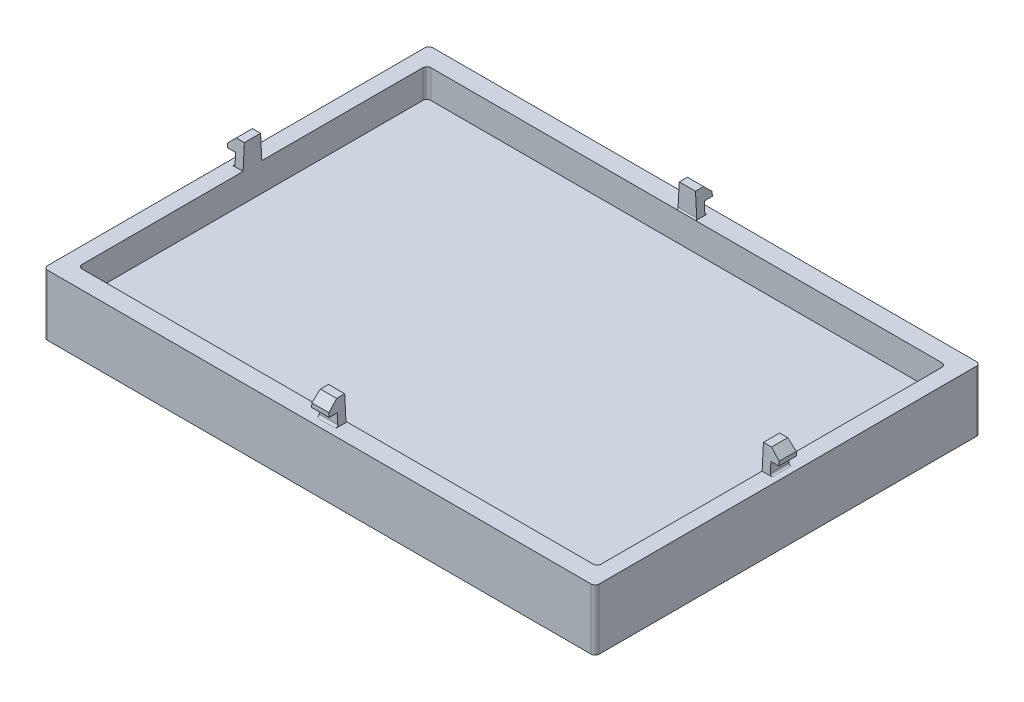
from build123d import *

# Parameters (mm, degrees)
SKETCH1_W            = 136
SKETCH1_H            = 95
BOSS_EXTRUDE1_DEPTH  = 15
SKETCH2_W            = 128
SKETCH2_H            = 86
CUT_EXTRUDE1_DEPTH   = 7
SNAP_START           = 64
SNAP_HOOK2_DEPTH     = 2
SNAP_HOOK2_2_DEPTH   = 2
FILLET1_R            = 1
FILLET2_R            = 0.5
FILLET2_OF_MIRROR1_R = 0.5
SNAP_START_2         = 43.25
SNAP_HOOK3_DEPTH     = 2
FILLET3_R            = 0.5
FILLET3_OF_MIRROR2_R = 0.5


with BuildPart() as part:
    # Sketch1 → Boss-Extrude1 (new body)
    with BuildSketch(Plane(origin=(0, 0, 0), x_dir=(1, 0, 0), z_dir=(0, 1, 0))):
        Rectangle(SKETCH1_W, SKETCH1_H)
    extrude(amount=BOSS_EXTRUDE1_DEPTH)

    # Sketch2 → Cut-Extrude1 (cut)
    with BuildSketch(Plane(origin=(0, 15, 0), x_dir=(1, 0, 0), z_dir=(0, 1, 0))):
        Rectangle(SKETCH2_W, SKETCH2_H)
    extrude(amount=-CUT_EXTRUDE1_DEPTH, mode=Mode.SUBTRACT)



with BuildPart() as body_2:
    # Snap Hook2: read off the stored shape, not the designer's step
    # Snap Hook2 outline → Snap Hook2 (new body)
    with BuildSketch(Plane.YZ.offset(SNAP_START)):
        Polygon((21, -2), (21, 2), (18, 2.157223338), (18, -2.157223338), align=None)
    snap_hook2 = extrude(amount=SNAP_HOOK2_DEPTH)


with BuildPart() as part_1:
    add(part.part)

    add(body_2.part)  # Snap Hook2 2 merges body 2
    # Snap Hook2 2 outline → Snap Hook2 2 (add)
    with BuildSketch(Plane.YZ.offset(SNAP_START)):
        Polygon((18, -2.157223338), (18, 2.157223338), (15, 2.314446676), (15, -2.314446676), align=None)
    snap_hook2_2 = extrude(amount=SNAP_HOOK2_2_DEPTH)

    # Snap Hook2 3: loft between two sections, ruled curve by curve
    snap_hook2_3_from = [
        Edge.make_line((66, 21, -2), (66, 21, 2)),
        Edge.make_line((66, 18, 2.157223338), (66, 18, -2.157223338)),
        Edge.make_line((66, 18, 2.157223338), (66, 21, 2)),
        Edge.make_line((66, 18, -2.157223338), (66, 21, -2)),
    ]
    snap_hook2_3_to = [
        Edge.make_line((68, 19, -2.104815559), (68, 19, 2.104815559)),
        Edge.make_line((68, 18, 2.157223338), (68, 18, -2.157223338)),
        Edge.make_line((68, 18, 2.157223338), (68, 19, 2.104815559)),
        Edge.make_line((68, 18, -2.157223338), (68, 19, -2.104815559)),
    ]
    snap_hook2_3 = Solid(Shell([*[Face.make_surface_from_curves(snap_hook2_3_from[k], snap_hook2_3_to[k]) for k in range(4)], Face(Wire(snap_hook2_3_from)), Face(Wire(snap_hook2_3_to))]))
    add(snap_hook2_3)

    # Fillet1
    fillet1_edges = [part_1.edges().sort_by_distance(p)[0] for p in [
        (-64, 11.5, 43),
        (-64, 11.5, -43),
        (64, 11.5, -43),
        (64, 11.5, 43),
        (68, 7.5, 47.5),
        (68, 7.5, -47.5),
        (-68, 7.5, -47.5),
        (-68, 7.5, 47.5),
    ]]
    fillet(fillet1_edges, radius=FILLET1_R)

    # Fillet2
    fillet2_edges = [part_1.edges().sort_by_distance(p)[0] for p in [
        (66, 15, 0),
    ]]
    fillet(fillet2_edges, radius=FILLET2_R)

    # Mirror1: Snap Hook2, Snap Hook2 2, Snap Hook2 3 across plane
    add(snap_hook2.mirror(Plane(origin=(0, 0, 0), x_dir=(0, 0, 1), z_dir=(1, 0, 0))))
    add(snap_hook2_2.mirror(Plane(origin=(0, 0, 0), x_dir=(0, 0, 1), z_dir=(1, 0, 0))))
    add(snap_hook2_3.mirror(Plane(origin=(0, 0, 0), x_dir=(0, 0, 1), z_dir=(1, 0, 0))))

    # Fillet2 of Mirror1
    fillet2_of_mirror1_edges = [part_1.edges().sort_by_distance(p)[0] for p in [
        (-66, 15, 0),
    ]]
    fillet(fillet2_of_mirror1_edges, radius=FILLET2_OF_MIRROR1_R)

    # Snap Hook3: read off the stored shape, not the designer's step
    # Snap Hook3 outline → Snap Hook3 (add)
    with BuildSketch(Plane.XY.offset(SNAP_START_2)):
        Polygon((2, 21), (-2, 21), (-2.314446676, 15), (2.314446676, 15), align=None)
    snap_hook3 = extrude(amount=SNAP_HOOK3_DEPTH)

    # Snap Hook3 2: loft between two sections, ruled curve by curve
    snap_hook3_2_from = [
        Edge.make_line((-2.157223338, 18, 45.25), (2.157223338, 18, 45.25)),
        Edge.make_line((2, 21, 45.25), (-2, 21, 45.25)),
        Edge.make_line((2, 21, 45.25), (2.157223338, 18, 45.25)),
        Edge.make_line((-2, 21, 45.25), (-2.157223338, 18, 45.25)),
    ]
    snap_hook3_2_to = [
        Edge.make_line((-2.157223338, 18, 47.25), (2.157223338, 18, 47.25)),
        Edge.make_line((2.104815559, 19, 47.25), (-2.104815559, 19, 47.25)),
        Edge.make_line((2.104815559, 19, 47.25), (2.157223338, 18, 47.25)),
        Edge.make_line((-2.104815559, 19, 47.25), (-2.157223338, 18, 47.25)),
    ]
    snap_hook3_2 = Solid(Shell([*[Face.make_surface_from_curves(snap_hook3_2_from[k], snap_hook3_2_to[k]) for k in range(4)], Face(Wire(snap_hook3_2_from)), Face(Wire(snap_hook3_2_to))]))
    add(snap_hook3_2)

    # Fillet3
    # the kernel refuses this fillet: 0.5 mm, written as the material it adds along each edge
    with BuildSketch(Plane(origin=(-3.564446676, 15, 45.25), x_dir=(0, 0, 1), z_dir=(1, 0, 0))) as fillet3_piece_1_section:
        with BuildLine():
            CenterArc((FILLET3_R, -FILLET3_R), FILLET3_R, 90, 90)
            Line((0, -FILLET3_R), (-FILLET3_R * 0.02, -FILLET3_R))
            Line((-FILLET3_R * 0.02, -FILLET3_R), (-FILLET3_R * 0.02, FILLET3_R * 0.02))
            Line((-FILLET3_R * 0.02, FILLET3_R * 0.02), (FILLET3_R, FILLET3_R * 0.02))
            Line((FILLET3_R, FILLET3_R * 0.02), (FILLET3_R, 0))
        make_face()
    fillet3_piece_1 = extrude(amount=7.128893352, mode=Mode.PRIVATE)
    fillet3_piece_1 = split(fillet3_piece_1, bisect_by=Plane(origin=(2.29834408, 15.307255844, 45.25), z_dir=(-0.998629534751949, -0.05233595629302951, 0)), keep=Keep.TOP, mode=Mode.PRIVATE)
    fillet3_piece_1 = split(fillet3_piece_1, bisect_by=Plane(origin=(-2.317870491, 14.93466971, 45.25), z_dir=(0.998629534751949, -0.05233595629302951, 0)), keep=Keep.TOP, mode=Mode.PRIVATE)
    add(fillet3_piece_1)
    with BuildSketch(Plane(origin=(-3.396978431, 15, 43.25), x_dir=(0, 0, -1), z_dir=(1, 0, 0))) as fillet3_piece_2_section:
        with BuildLine():
            CenterArc((0.5, 0.433012702), FILLET3_R, 180, 60)
            Line((0, 0.433012702), (-0.01, 0.433012702))
            Line((-0.01, 0.433012702), (-0.01, 0))
            Line((-0.01, 0), (0, -0.01))
            ThreePointArc((0, -0.01), (0.125, -0.01), (0.245, -0.008660254))
            Line((0.245, -0.008660254), (0.25, 0))
        make_face()
    fillet3_piece_2 = extrude(amount=6.793956861, mode=Mode.PRIVATE)
    fillet3_piece_2 = split(fillet3_piece_2, bisect_by=Plane(origin=(2.298802784, 15.298503245, 43.25), z_dir=(-0.998629534751949, -0.05233595629302951, 0)), keep=Keep.TOP, mode=Mode.PRIVATE)
    fillet3_piece_2 = split(fillet3_piece_2, bisect_by=Plane(origin=(-2.317411787, 14.94342231, 43.25), z_dir=(0.998629534751949, -0.05233595629302951, 0)), keep=Keep.TOP, mode=Mode.PRIVATE)
    add(fillet3_piece_2)

    # Mirror2: Snap Hook3, Snap Hook3 2 across plane
    add(snap_hook3.mirror(Plane.XY))
    add(snap_hook3_2.mirror(Plane.XY))

    # Fillet3 of Mirror2
    # the kernel refuses this fillet: 0.5 mm, written as the material it adds along each edge
    with BuildSketch(Plane(origin=(-3.564446676, 15, -45.25), x_dir=(0, 0, -1), z_dir=(1, 0, 0))) as fillet3_of_mirror2_piece_1_section:
        with BuildLine():
            CenterArc((FILLET3_OF_MIRROR2_R, FILLET3_OF_MIRROR2_R), FILLET3_OF_MIRROR2_R, 180, 90)
            Line((0, FILLET3_OF_MIRROR2_R), (-FILLET3_OF_MIRROR2_R * 0.02, FILLET3_OF_MIRROR2_R))
            Line((-FILLET3_OF_MIRROR2_R * 0.02, FILLET3_OF_MIRROR2_R), (-FILLET3_OF_MIRROR2_R * 0.02, -FILLET3_OF_MIRROR2_R * 0.02))
            Line((-FILLET3_OF_MIRROR2_R * 0.02, -FILLET3_OF_MIRROR2_R * 0.02), (FILLET3_OF_MIRROR2_R, -FILLET3_OF_MIRROR2_R * 0.02))
            Line((FILLET3_OF_MIRROR2_R, -FILLET3_OF_MIRROR2_R * 0.02), (FILLET3_OF_MIRROR2_R, 0))
        make_face()
    fillet3_of_mirror2_piece_1 = extrude(amount=7.128893352, mode=Mode.PRIVATE)
    fillet3_of_mirror2_piece_1 = split(fillet3_of_mirror2_piece_1, bisect_by=Plane(origin=(-2.317870491, 14.93466971, -45.25), z_dir=(0.998629534751949, -0.05233595629302951, 0)), keep=Keep.TOP, mode=Mode.PRIVATE)
    fillet3_of_mirror2_piece_1 = split(fillet3_of_mirror2_piece_1, bisect_by=Plane(origin=(2.29834408, 15.307255844, -45.25), z_dir=(-0.998629534751949, -0.05233595629302951, 0)), keep=Keep.TOP, mode=Mode.PRIVATE)
    add(fillet3_of_mirror2_piece_1)
    with BuildSketch(Plane(origin=(-3.396978431, 15, -43.25), x_dir=(0, 0, 1), z_dir=(1, 0, 0))) as fillet3_of_mirror2_piece_2_section:
        with BuildLine():
            CenterArc((0.5, -0.433012702), FILLET3_OF_MIRROR2_R, 120, 60)
            Line((0, -0.433012702), (-0.01, -0.433012702))
            Line((-0.01, -0.433012702), (-0.01, 0))
            Line((-0.01, 0), (0, 0.01))
            ThreePointArc((0, 0.01), (0.125, 0.01), (0.245, 0.008660254))
            Line((0.245, 0.008660254), (0.25, 0))
        make_face()
    fillet3_of_mirror2_piece_2 = extrude(amount=6.793956861, mode=Mode.PRIVATE)
    fillet3_of_mirror2_piece_2 = split(fillet3_of_mirror2_piece_2, bisect_by=Plane(origin=(-2.317411787, 14.94342231, -43.25), z_dir=(0.998629534751949, -0.05233595629302951, 0)), keep=Keep.TOP, mode=Mode.PRIVATE)
    fillet3_of_mirror2_piece_2 = split(fillet3_of_mirror2_piece_2, bisect_by=Plane(origin=(2.298802784, 15.298503245, -43.25), z_dir=(-0.998629534751949, -0.05233595629302951, 0)), keep=Keep.TOP, mode=Mode.PRIVATE)
    add(fillet3_of_mirror2_piece_2)


solid = part_1.part
